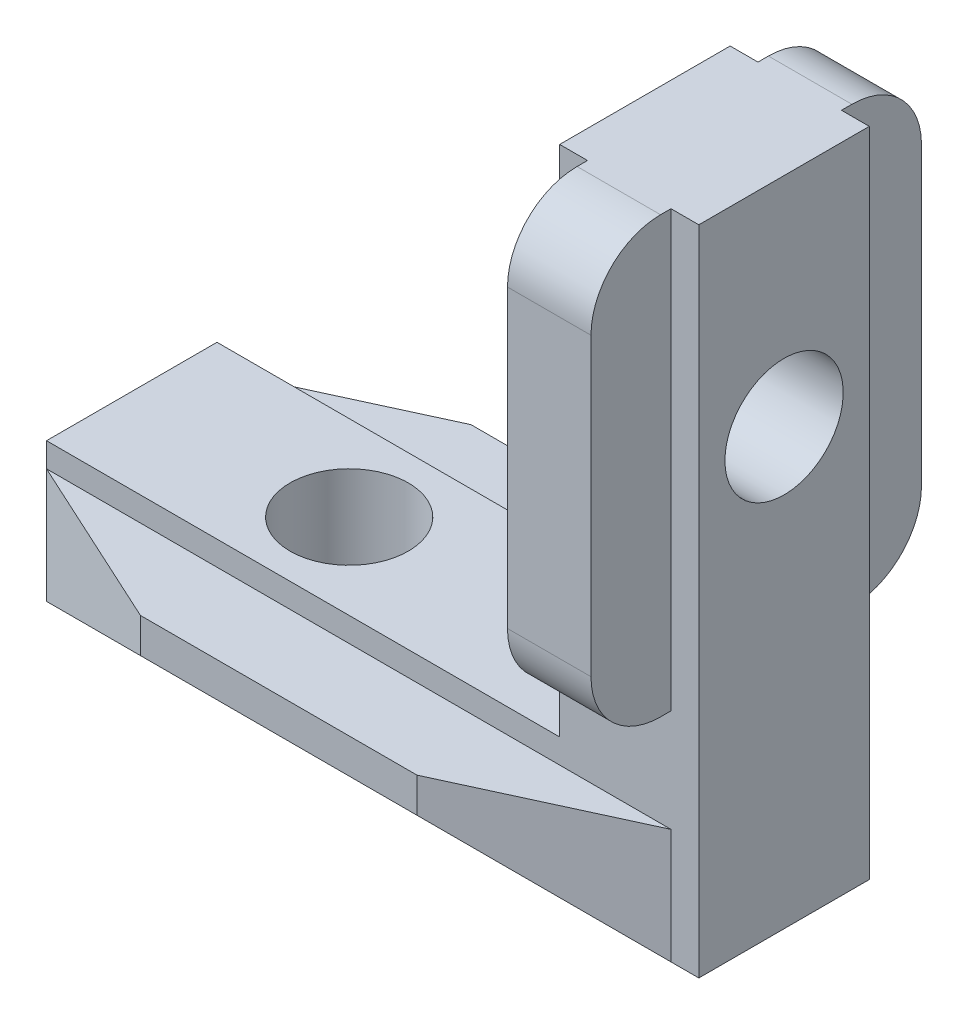
from build123d import *
from OCP.BRepFilletAPI import BRepFilletAPI_MakeChamfer

# Parameters (mm, degrees)
EXTRUDE_1_DEPTH  = 4.9
EXTRUDE_2_DEPTH  = 35.9
CHAMFER_1_SIZE   = 10
CHAMFER_1_SIZE2  = 4.6
CHAMFER_2_SIZE   = 10
CHAMFER_2_SIZE_2 = 4.6
EXTRUDE_3_DEPTH  = 2.4


with BuildPart() as part:
    # 草图1 → 凸台-拉伸1 (new, symmetric)
    with BuildSketch(Plane.XY):
        Polygon((-37.5, 0), (0, 0), (0, 37.5), (-8, 37.5), (-8, 8), (-37.5, 8), align=None)
    extrude(amount=EXTRUDE_1_DEPTH, both=True)

    # 草图3 → 凸台-拉伸2 (add)
    with BuildSketch(Plane.ZY.offset(37.5)):
        Polygon((-4.9, 0), (-9.5, 4.6), (-9.5, 6.6), (-4.9, 6.6), align=None)
        Polygon((4.9, 6.6), (4.9, 0), (9.5, 4.6), (9.5, 6.6), align=None)
    extrude(amount=-EXTRUDE_2_DEPTH)

    # 倒角1: one chamfer whose edges measure the first distance from different faces: ONE call of the kernel's chamfer builder (chamfer() names one face for all edges)
    chamfer_1_edges_1 = [part.edges().sort_by_distance(p)[0] for p in [
        (-37.5, 5.6, 9.5),
    ]]
    chamfer_1_side_1 = [part.faces().sort_by_distance(p)[0] for p in [
        (-19.55, 5.6, 9.5),
    ]]
    chamfer_1_edges_2 = [part.edges().sort_by_distance(p)[0] for p in [
        (-37.5, 5.6, -9.5),
    ]]
    chamfer_1_side_2 = [part.faces().sort_by_distance(p)[0] for p in [
        (-19.55, 5.6, -9.5),
    ]]
    chamfer_1 = BRepFilletAPI_MakeChamfer(part.part.solid().wrapped)
    for e in chamfer_1_edges_1:
        chamfer_1.Add(CHAMFER_1_SIZE, CHAMFER_1_SIZE2, e.wrapped, chamfer_1_side_1[0].wrapped)  # the first distance lies on this face
    for e in chamfer_1_edges_2:
        chamfer_1.Add(CHAMFER_1_SIZE, CHAMFER_1_SIZE2, e.wrapped, chamfer_1_side_2[0].wrapped)  # the first distance lies on this face
    add(Compound.cast(chamfer_1.Shape()), mode=Mode.REPLACE)

    # 倒角2
    chamfer_2_edges_1 = [part.edges().sort_by_distance(p)[0] for p in [
        (-1.6, 5.6, 9.5),
    ]]
    chamfer_2_side_1 = [part.faces().sort_by_distance(p)[0] for p in [
        (-1.692, 5.6, 9.5),
    ]]
    chamfer_2_edges_2 = [part.edges().sort_by_distance(p)[0] for p in [
        (-1.6, 5.6, -9.5),
    ]]
    chamfer_2_side_2 = [part.faces().sort_by_distance(p)[0] for p in [
        (-1.692, 5.6, -9.5),
    ]]
    chamfer_2 = BRepFilletAPI_MakeChamfer(part.part.solid().wrapped)
    for e in chamfer_2_edges_1:
        chamfer_2.Add(CHAMFER_2_SIZE - 0.0001, CHAMFER_2_SIZE_2 - 0.0001, e.wrapped, chamfer_2_side_1[0].wrapped)
    for e in chamfer_2_edges_2:
        chamfer_2.Add(CHAMFER_2_SIZE - 0.0001, CHAMFER_2_SIZE_2 - 0.0001, e.wrapped, chamfer_2_side_2[0].wrapped)
    add(Compound.cast(chamfer_2.Shape()), mode=Mode.REPLACE)  # a hair under: the kernel refuses the full size

    # 草图5 → 凸台-拉伸3 (add, symmetric)
    with BuildSketch(Plane.ZY.offset(4)):
        with BuildLine():
            Line((-4.9, 37.5), (-5.5, 37.5))
            ThreePointArc((-5.5, 37.5), (-8.328427125, 36.328427125), (-9.5, 33.5))
            Line((-9.5, 33.5), (-9.5, 16.5))
            ThreePointArc((-9.5, 16.5), (-8.328427125, 13.671572875), (-5.5, 12.5))
            Line((-5.5, 12.5), (-4.9, 12.5))
            Line((-4.9, 12.5), (-4.9, 37.5))
        make_face()
        with BuildLine():
            Line((4.9, 12.5), (4.9, 37.5))
            Line((4.9, 37.5), (5.5, 37.5))
            ThreePointArc((5.5, 37.5), (8.328427125, 36.328427125), (9.5, 33.5))
            Line((9.5, 33.5), (9.5, 16.5))
            ThreePointArc((9.5, 16.5), (8.328427125, 13.671572875), (5.5, 12.5))
            Line((5.5, 12.5), (4.9, 12.5))
        make_face()
    extrude(amount=EXTRUDE_3_DEPTH, both=True)

    # 草图7 → M8 螺纹孔1 (revolve, cut)
    with BuildSketch(Plane(origin=(-25, 8, 0), x_dir=(0, 0, 1), z_dir=(1, 0, 0))):
        Polygon((0, 0), (0, 21.792926105), (3.4, 19.75), (3.4, 0), align=None)
    hole_wizard_m8_1 = revolve(axis=Axis((-25, 14.35, 0), (0, -1, 0)), mode=Mode.SUBTRACT)

    # 镜向1: M8 螺纹孔1 across plane
    add(hole_wizard_m8_1.mirror(Plane(origin=(0, 0, 0), x_dir=(0, 0, 1), z_dir=(-0.7071067811865477, -0.7071067811865475, 0))), mode=Mode.SUBTRACT)


solid = part.part
